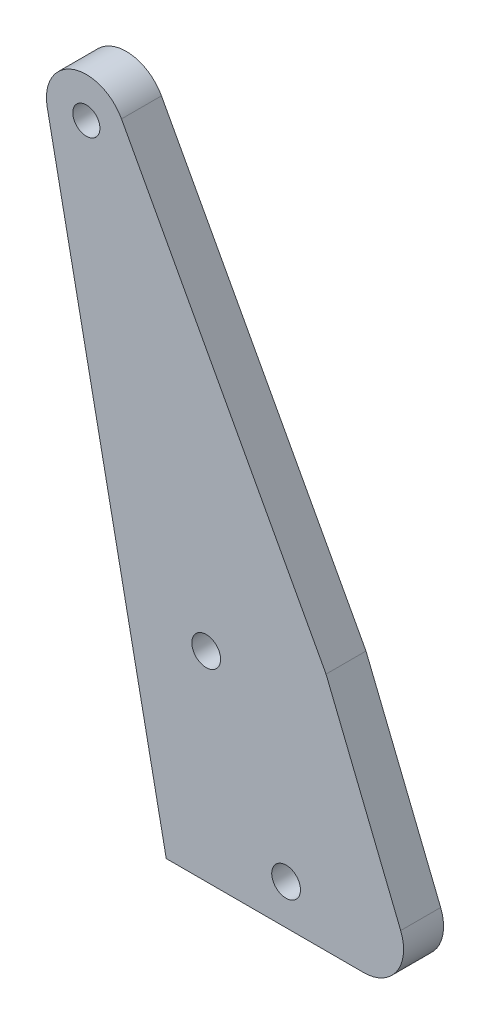
from build123d import *

# Parameters (mm, degrees)
SKETCH1_R           = 2.286
SKETCH1_R_2         = 2.159
BOSS_EXTRUDE1_DEPTH = 6.35
FILLET1_R           = 6.35


with BuildPart() as part:
    # Sketch1 → Boss-Extrude1 (new body)
    with BuildSketch(Plane.XY):
        with BuildLine():
            Line((0, 0), (-25.4, 0))
            Line((-25.4, 0), (-44.325080361, 93.996655935))
            ThreePointArc((-44.325080361, 93.996655935), (-40.259800375, 101.221411998), (-32.513466938, 98.268799625))
            Line((-32.513466938, 98.268799625), (0, 38.1))
            Line((0, 38.1), (15.393399204, 0))
            Line((15.393399204, 0), (0, 0))
        make_face()
        with Locations((-6.35, 6.35)):
            Circle(SKETCH1_R, mode=Mode.SUBTRACT)
        with Locations((-19.05, 31.75)):
            Circle(SKETCH1_R, mode=Mode.SUBTRACT)
        with Locations((-38.099999746, 95.25)):
            Circle(SKETCH1_R_2, mode=Mode.SUBTRACT)
    extrude(amount=-BOSS_EXTRUDE1_DEPTH)

    # Fillet1
    fillet1_edges = [part.edges().sort_by_distance(p)[0] for p in [
        (15.393399204, 0, -3.175),
    ]]
    fillet(fillet1_edges, radius=FILLET1_R)


solid = part.part
